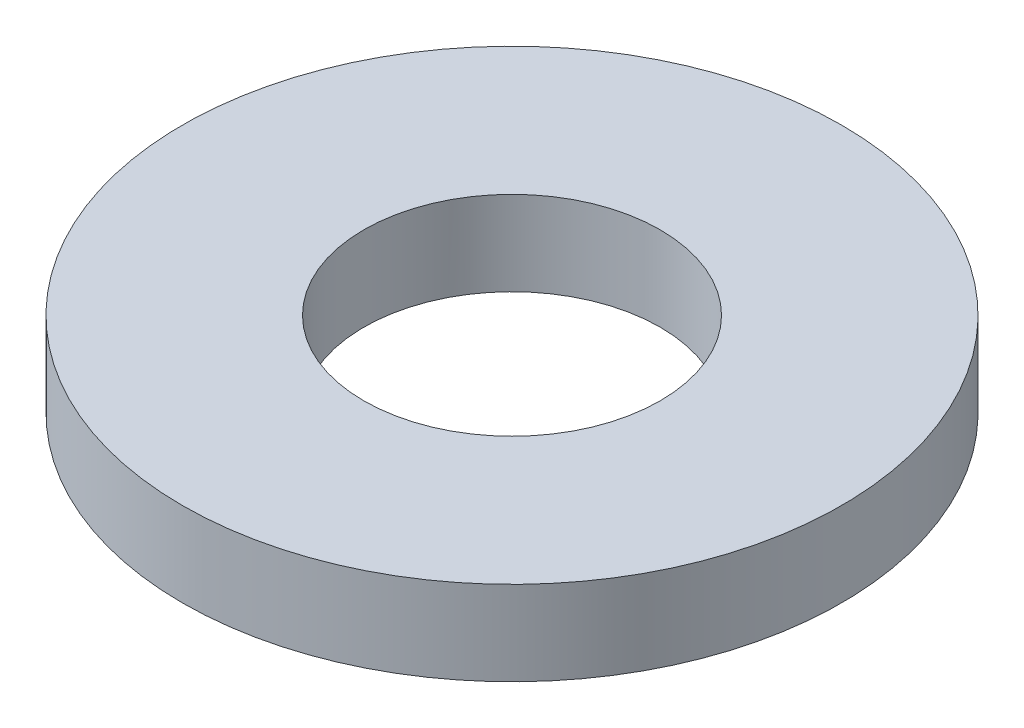
from build123d import *

# Parameters (mm, degrees)
SKETCH1_R           = 7.9375
BOSS_EXTRUDE2_DEPTH = 2.032
SKETCH3_R           = 3.5687
CUT_EXTRUDE1_DEPTH  = 3.302


with BuildPart() as part:
    # Sketch1 → Boss-Extrude2 (new body)
    with BuildSketch(Plane(origin=(0, 0, 0), x_dir=(1, 0, 0), z_dir=(0, 1, 0))):
        Circle(SKETCH1_R)
    extrude(amount=BOSS_EXTRUDE2_DEPTH)

    # Sketch3 → Cut-Extrude1 (cut)
    with BuildSketch(Plane(origin=(0, 0, 0), x_dir=(-1, 0, 0), z_dir=(0, -1, 0))):
        Circle(SKETCH3_R)
    extrude(amount=-CUT_EXTRUDE1_DEPTH, mode=Mode.SUBTRACT)


solid = part.part
